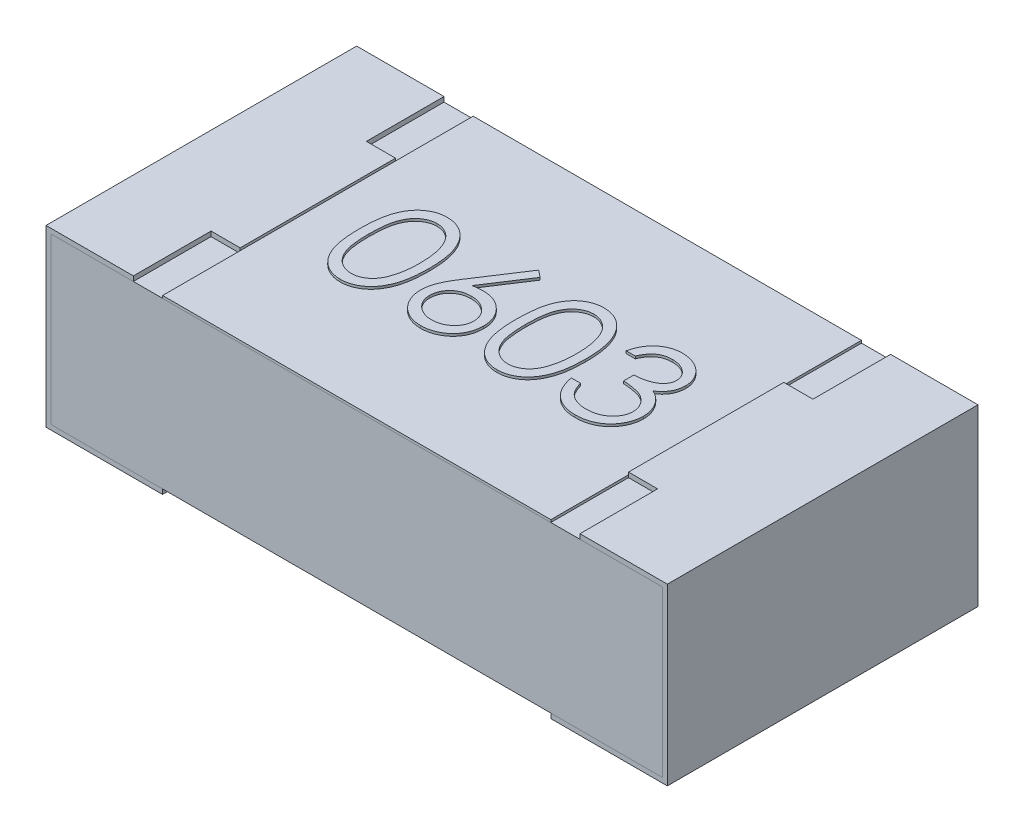
from build123d import *

# Parameters (mm, degrees)
CROQUIS1_W              = 1.6
CROQUIS1_H              = 0.8
SALIENTE_EXTRUIR1_DEPTH = 0.45
CROQUIS2_W              = 1
CROQUIS2_H              = 0.0125
CORTAR_EXTRUIR1_DEPTH   = 2.217579566
CROQUIS3_W              = 0.075
CROQUIS3_H              = 0.2
CORTAR_EXTRUIR3_DEPTH   = 0.0125
CROQUIS4_W              = 1
CROQUIS4_H              = 0.8
SALIENTE_EXTRUIR2_DEPTH = 0.00625
SALIENTE_EXTRUIR2_TAPER = 1
SALIENTE_EXTRUIR3_START = 0.44375
SALIENTE_EXTRUIR3_DEPTH = 0.00625


# Read off the part's stored shape, not the designer's step: Saliente-Extruir3
with BuildPart() as part:
    # Croquis1 → Saliente-Extruir1 (new body)
    with BuildSketch(Plane(origin=(0, 0, 0), x_dir=(1, 0, 0), z_dir=(0, 1, 0))):
        Rectangle(CROQUIS1_W, CROQUIS1_H)
    extrude(amount=SALIENTE_EXTRUIR1_DEPTH)

    # Croquis2 → Cortar-Extruir1 (cut, through all)
    with BuildSketch(Plane.XY.offset(0.4)):
        with Locations((0, 0.00625)):
            Rectangle(CROQUIS2_W, CROQUIS2_H)
        with Locations((0, 0.44375)):
            Rectangle(CROQUIS2_W, CROQUIS2_H)
    extrude(amount=-CORTAR_EXTRUIR1_DEPTH, mode=Mode.SUBTRACT)

    # Croquis3 → Cortar-Extruir3 (cut)
    with BuildSketch(Plane(origin=(0, 0.45, 0), x_dir=(1, 0, 0), z_dir=(0, 1, 0))):
        with Locations((-0.5375, -0.3)):
            Rectangle(CROQUIS3_W, CROQUIS3_H)
        with Locations((-0.5375, 0.3)):
            Rectangle(CROQUIS3_W, CROQUIS3_H)
        with Locations((0.5375, 0.3)):
            Rectangle(CROQUIS3_W, CROQUIS3_H)
        with Locations((0.5375, -0.3)):
            Rectangle(CROQUIS3_W, CROQUIS3_H)
    extrude(amount=-CORTAR_EXTRUIR3_DEPTH, mode=Mode.SUBTRACT)

    # Croquis4 → Saliente-Extruir2 (add)
    with BuildSketch(Plane(origin=(0, 0.4375, 0), x_dir=(1, 0, 0), z_dir=(0, 1, 0))):
        Rectangle(CROQUIS4_W, CROQUIS4_H)
    extrude(amount=SALIENTE_EXTRUIR2_DEPTH, taper=SALIENTE_EXTRUIR2_TAPER)

    # Saliente-Extruir3 outline → Saliente-Extruir3 (add)
    # profile 1 of 4: a face of its own
    with BuildSketch(Plane(origin=(0, 0, 0), x_dir=(1, 0, 0), z_dir=(0, 1, 0)).offset(SALIENTE_EXTRUIR3_START)):
        with BuildLine():
            add(Edge.make_bspline(
                [(-0.301302966, -0.141120437), (-0.303372124, -0.14108548), (-0.307452102, -0.141016551), (-0.313497674, -0.140303417), (-0.319365596, -0.139156892), (-0.325084825, -0.137551538), (-0.330684702, -0.135586518), (-0.33608892, -0.133026414), (-0.341357568, -0.130077997), (-0.34647659, -0.126720207), (-0.351349795, -0.122873218), (-0.356004603, -0.118618261), (-0.360324079, -0.113849155), (-0.364344402, -0.108641205), (-0.368165336, -0.103042323), (-0.371680086, -0.096976066), (-0.374931093, -0.090466488), (-0.377902704, -0.083471532), (-0.380537389, -0.075889126), (-0.382864674, -0.067632525), (-0.384702215, -0.058628856), (-0.386275062, -0.048950432), (-0.387543686, -0.038555663), (-0.388409779, -0.027438908), (-0.38894508, -0.015607092), (-0.388992684, -0.007491369), (-0.389017144, -0.003321411)],
                knots=[0, 0, 0, 0, 0.033787146, 0.066621658, 0.099284878, 0.131361165, 0.163585188, 0.196103927, 0.228902254, 0.262158056, 0.295991222, 0.330217846, 0.365059826, 0.400950737, 0.437620382, 0.475707529, 0.515380692, 0.556413541, 0.59976483, 0.646424156, 0.696431445, 0.749781518, 0.806573307, 0.867435532, 0.931886753, 1, 1, 1, 1], degree=3))
            add(Edge.make_bspline(
                [(-0.210750822, -0.003321411), (-0.210799663, -0.007333474), (-0.210894829, -0.015150817), (-0.211387958, -0.026584286), (-0.212359316, -0.037378141), (-0.21357439, -0.047558269), (-0.215257277, -0.057082298), (-0.217326514, -0.065983185), (-0.219624012, -0.074299369), (-0.222460045, -0.081962722), (-0.225564124, -0.089080146), (-0.228941387, -0.095726489), (-0.232559613, -0.101960496), (-0.236501578, -0.10773227), (-0.24070325, -0.113082696), (-0.245254555, -0.117917331), (-0.250027196, -0.122352667), (-0.255080319, -0.126299346), (-0.260358253, -0.129753786), (-0.265752186, -0.132843108), (-0.271357825, -0.135334176), (-0.277048134, -0.137473116), (-0.282904507, -0.139107242), (-0.288919644, -0.140237153), (-0.295062948, -0.141029601), (-0.299215758, -0.141090053), (-0.301302966, -0.141120437)],
                knots=[0, 0, 0, 0, 0.06506329, 0.126773166, 0.185515763, 0.240764679, 0.292979796, 0.342250373, 0.388919286, 0.432775664, 0.474628433, 0.514774691, 0.553605893, 0.591426406, 0.62802812, 0.663803634, 0.698984336, 0.733591489, 0.767628469, 0.801208348, 0.83426384, 0.866980695, 0.899719742, 0.932701912, 0.966175883, 1, 1, 1, 1], degree=3))
            add(Edge.make_bspline(
                [(-0.301302966, 0.134687835), (-0.299216464, 0.134651269), (-0.295067069, 0.134578551), (-0.28893245, 0.133879644), (-0.282939554, 0.132719954), (-0.277113931, 0.131076794), (-0.271407728, 0.129038251), (-0.265865577, 0.126483137), (-0.260453054, 0.123508875), (-0.25525617, 0.120014026), (-0.250217874, 0.116117521), (-0.24546192, 0.111712769), (-0.240987874, 0.106844245), (-0.236739587, 0.101564039), (-0.232837586, 0.095770877), (-0.229121643, 0.089565517), (-0.225795589, 0.08283944), (-0.222592268, 0.07570487), (-0.219827281, 0.067964397), (-0.217333698, 0.059661654), (-0.215318895, 0.05069857), (-0.213640632, 0.041122174), (-0.212340488, 0.030897294), (-0.211393566, 0.020045851), (-0.210893362, 0.008560704), (-0.210799162, 0.000708229), (-0.210750822, -0.003321411)],
                knots=[0, 0, 0, 0, 0.033788116, 0.067193932, 0.099862411, 0.132566612, 0.165151173, 0.197913187, 0.231319004, 0.265083278, 0.299255309, 0.334398567, 0.369942824, 0.406283561, 0.44406382, 0.482997707, 0.523354447, 0.56553659, 0.609612924, 0.656390811, 0.705885495, 0.7583245, 0.813831783, 0.872794559, 0.93472223, 1, 1, 1, 1], degree=3))
            add(Edge.make_bspline(
                [(-0.389017144, -0.003321411), (-0.388992556, 0.000883557), (-0.388944794, 0.009051766), (-0.388413458, 0.020954), (-0.387530798, 0.032119817), (-0.386321167, 0.042549751), (-0.384849136, 0.052246495), (-0.382884067, 0.061184135), (-0.380649348, 0.069404038), (-0.378059354, 0.076933008), (-0.375136894, 0.083872479), (-0.371956092, 0.090350769), (-0.368390714, 0.096358076), (-0.364644527, 0.101990281), (-0.360565888, 0.107155188), (-0.356270866, 0.111925736), (-0.351591825, 0.116191672), (-0.346687825, 0.120077985), (-0.341514465, 0.123484802), (-0.336219207, 0.12648559), (-0.330765605, 0.129049156), (-0.325138768, 0.131064818), (-0.319389271, 0.132729706), (-0.313497015, 0.133868245), (-0.307452272, 0.134584615), (-0.303372182, 0.134653102), (-0.301302966, 0.134687835)],
                knots=[0, 0, 0, 0, 0.068594622, 0.133246042, 0.194312586, 0.251279223, 0.304513439, 0.354234907, 0.400480589, 0.443410755, 0.484014869, 0.523252301, 0.561042373, 0.597900239, 0.633518489, 0.668314351, 0.702495671, 0.736685354, 0.770293169, 0.803437255, 0.835912952, 0.868460246, 0.900846538, 0.933466525, 0.966257575, 1, 1, 1, 1], degree=3))
        make_face()
        with BuildLine():
            add(Edge.make_bspline(
                [(-0.300514642, 0.107779711), (-0.303416324, 0.107627437), (-0.309224974, 0.107322612), (-0.317803803, 0.105171813), (-0.32602706, 0.101422924), (-0.332566649, 0.097303785), (-0.337578648, 0.093380592), (-0.341107889, 0.089978498), (-0.344417013, 0.086257097), (-0.347465396, 0.08217922), (-0.350320506, 0.077796752), (-0.352942625, 0.073075219), (-0.355305111, 0.067990692), (-0.35748524, 0.062547484), (-0.359402134, 0.056582228), (-0.360983303, 0.05000321), (-0.36244402, 0.042772586), (-0.36347809, 0.034848026), (-0.364397361, 0.026281625), (-0.364988134, 0.017040961), (-0.365447723, 0.007141634), (-0.365464099, 0.000305496), (-0.365472535, -0.003216301)],
                knots=[0, 0, 0, 0, 0.060386619, 0.120883249, 0.182754619, 0.24781103, 0.2812991, 0.315087624, 0.349702396, 0.384856581, 0.420966197, 0.458511188, 0.497174722, 0.537602048, 0.580503018, 0.62746754, 0.67838821, 0.733983221, 0.793746705, 0.857713672, 0.926697864, 1, 1, 1, 1], degree=3))
            add(Edge.make_bspline(
                [(-0.23429543, -0.003216301), (-0.234336671, -6.2985e-05), (-0.234417348, 0.006105574), (-0.234725726, 0.015139418), (-0.235522051, 0.023719732), (-0.236406494, 0.031883481), (-0.237710561, 0.039585473), (-0.239116615, 0.046890187), (-0.241005656, 0.053707126), (-0.243023518, 0.060143018), (-0.245333014, 0.066124743), (-0.247875282, 0.07168019), (-0.250590405, 0.076836179), (-0.253539434, 0.081578564), (-0.256687361, 0.085928588), (-0.260117271, 0.089799031), (-0.263693112, 0.093309853), (-0.268701618, 0.097317319), (-0.275258546, 0.101403425), (-0.283417435, 0.105163768), (-0.291908015, 0.10732319), (-0.297647835, 0.107627647), (-0.300514642, 0.107779711)],
                knots=[0, 0, 0, 0, 0.065681198, 0.128486464, 0.18817513, 0.245106131, 0.299448425, 0.350822936, 0.399941681, 0.446671744, 0.491254533, 0.533376344, 0.573852755, 0.612526312, 0.649597136, 0.685532042, 0.720105786, 0.753837663, 0.818925416, 0.880493462, 0.940311334, 1, 1, 1, 1], degree=3))
            add(Edge.make_bspline(
                [(-0.244228312, -0.069172738), (-0.243437369, -0.066831808), (-0.241831415, -0.062078717), (-0.239761682, -0.054705541), (-0.238131683, -0.046969632), (-0.236665246, -0.038917223), (-0.235664323, -0.030488929), (-0.234858684, -0.021710828), (-0.234384146, -0.012576302), (-0.234325323, -0.006370127), (-0.23429543, -0.003216301)],
                knots=[0, 0, 0, 0, 0.110588339, 0.224541754, 0.342503494, 0.464324098, 0.590756033, 0.722227475, 0.858842836, 1, 1, 1, 1], degree=3))
            add(Edge.make_bspline(
                [(-0.300514642, -0.114212313), (-0.297609431, -0.114092546), (-0.291805007, -0.113853259), (-0.283324685, -0.111544637), (-0.27509199, -0.108061357), (-0.268640179, -0.103942583), (-0.263731716, -0.100020138), (-0.260214896, -0.096675898), (-0.256987036, -0.092931288), (-0.253925582, -0.088891086), (-0.251117712, -0.084478102), (-0.248564395, -0.079713557), (-0.246234439, -0.074584219), (-0.244906998, -0.071003478), (-0.244228312, -0.069172738)],
                knots=[0, 0, 0, 0, 0.112813401, 0.225393884, 0.339594815, 0.45967541, 0.52173519, 0.583925839, 0.648174145, 0.713881038, 0.781004455, 0.851450928, 0.924050693, 1, 1, 1, 1], degree=3))
            add(Edge.make_bspline(
                [(-0.365472535, -0.003216301), (-0.365463582, -0.006720506), (-0.365446204, -0.01352148), (-0.364992242, -0.023404233), (-0.364373818, -0.032621885), (-0.363576164, -0.041186141), (-0.362391601, -0.049068012), (-0.361064329, -0.056321708), (-0.35944912, -0.06290884), (-0.357538056, -0.068874611), (-0.355361333, -0.074320265), (-0.352984714, -0.07938754), (-0.350431579, -0.084136296), (-0.34757423, -0.088523879), (-0.34446233, -0.092564596), (-0.341166167, -0.096329966), (-0.337562726, -0.099687873), (-0.332577715, -0.103715149), (-0.325996637, -0.107876772), (-0.31770471, -0.111500715), (-0.309184311, -0.113778133), (-0.303401181, -0.114067754), (-0.300514642, -0.114212313)],
                knots=[0, 0, 0, 0, 0.072951066, 0.141583694, 0.20592646, 0.265301357, 0.320597233, 0.371816503, 0.41878977, 0.461698729, 0.502133582, 0.540804315, 0.578180525, 0.614296865, 0.649678243, 0.68429946, 0.718358953, 0.752080865, 0.817652439, 0.879722076, 0.93996556, 1, 1, 1, 1], degree=3))
        make_face(mode=Mode.SUBTRACT)
    # profile 2 of 4: a face of its own
    with BuildSketch(Plane(origin=(0, 0, 0), x_dir=(1, 0, 0), z_dir=(0, 1, 0)).offset(SALIENTE_EXTRUIR3_START)):
        with BuildLine():
            add(Edge.make_bspline(
                [(-0.173752151, -0.061236944), (-0.173663592, -0.058535101), (-0.173482771, -0.053018455), (-0.172220218, -0.044663296), (-0.170191486, -0.036114216), (-0.16791948, -0.028861682), (-0.165518893, -0.022920369), (-0.163521063, -0.018130269), (-0.161034395, -0.013200928), (-0.158382865, -0.007963316), (-0.155327798, -0.002552415), (-0.15200597, 0.003122207), (-0.148325541, 0.008970302), (-0.145745463, 0.012938911), (-0.1444265, 0.014967705)],
                knots=[0, 0, 0, 0, 0.09781819, 0.199726053, 0.305276357, 0.415811491, 0.474472231, 0.53727388, 0.603657421, 0.674298863, 0.749834485, 0.828598477, 0.912377778, 1, 1, 1, 1], degree=3))
            add(Edge.make_bspline(
                [(-0.094289097, -0.141120437), (-0.097819388, -0.141005885), (-0.104812276, -0.140778978), (-0.115099019, -0.138757656), (-0.124983252, -0.135481444), (-0.134395726, -0.130967881), (-0.143114926, -0.125266708), (-0.150915514, -0.118403351), (-0.157758595, -0.11052452), (-0.163453527, -0.101631435), (-0.167970421, -0.092074999), (-0.171357783, -0.08211025), (-0.173336402, -0.071773495), (-0.17361289, -0.064766304), (-0.173752151, -0.061236944)],
                knots=[0, 0, 0, 0, 0.084334722, 0.167052318, 0.249566077, 0.332740482, 0.415914886, 0.49782801, 0.580372589, 0.664600121, 0.749466693, 0.832510234, 0.915639282, 1, 1, 1, 1], degree=3))
            add(Edge.make_bspline(
                [(-0.012303406, -0.060763949), (-0.01241008, -0.064435387), (-0.012619988, -0.071659907), (-0.014711611, -0.082182313), (-0.017961778, -0.092206681), (-0.022607511, -0.101572964), (-0.028377983, -0.110268325), (-0.035414892, -0.117972953), (-0.043468678, -0.124844387), (-0.052575128, -0.130590441), (-0.062375404, -0.135283062), (-0.072671082, -0.138653582), (-0.083362177, -0.140728689), (-0.090618491, -0.14098884), (-0.094289097, -0.141120437)],
                knots=[0, 0, 0, 0, 0.085947943, 0.169125212, 0.250399107, 0.332289736, 0.413364288, 0.494172283, 0.576021735, 0.660756969, 0.745783126, 0.830043593, 0.914027546, 1, 1, 1, 1], degree=3))
            add(Edge.make_bspline(
                [(-0.090137257, 0.016964792), (-0.087470802, 0.016893124), (-0.082221964, 0.016752046), (-0.074515736, 0.015666361), (-0.067110681, 0.013955428), (-0.06003749, 0.011461395), (-0.053270777, 0.008275489), (-0.046771709, 0.004457195), (-0.040662453, -0.000190648), (-0.034864337, -0.005382635), (-0.029600229, -0.011133213), (-0.024939615, -0.017234922), (-0.021024781, -0.023681406), (-0.017848502, -0.030469399), (-0.015382007, -0.037588437), (-0.013583933, -0.045029413), (-0.012521054, -0.052797457), (-0.012376722, -0.058080384), (-0.012303406, -0.060763949)],
                knots=[0, 0, 0, 0, 0.065230804, 0.128404896, 0.190067072, 0.250943366, 0.311545833, 0.372862802, 0.435023674, 0.499071725, 0.563091075, 0.625510106, 0.686680036, 0.747282503, 0.808563495, 0.870742104, 0.934340952, 1, 1, 1, 1], degree=3))
            add(Edge.make_bspline(
                [(-0.117308156, 0.014442156), (-0.11269295, 0.015177786), (-0.103690469, 0.016612717), (-0.09457809, 0.016849432), (-0.090137257, 0.016964792)],
                knots=[0, 0, 0, 0, 0.512659336, 1, 1, 1, 1], degree=3))
            Line((-0.117308156, 0.014442156), (-0.047988204, 0.120445449))
            Line((-0.047988204, 0.120445449), (-0.066119655, 0.134687835))
            Line((-0.066119655, 0.134687835), (-0.1444265, 0.014967705))
        make_face()
        with BuildLine():
            add(Edge.make_bspline(
                [(-0.035848015, -0.062182932), (-0.035889264, -0.060391836), (-0.035970222, -0.056876497), (-0.03688591, -0.051727787), (-0.038155882, -0.046756159), (-0.040073544, -0.04199286), (-0.0425649, -0.037456686), (-0.045599469, -0.033124723), (-0.049109961, -0.02896376), (-0.053165023, -0.025098697), (-0.057579338, -0.02156463), (-0.062272899, -0.018444897), (-0.067183268, -0.015811987), (-0.072305467, -0.013615175), (-0.077698187, -0.012029845), (-0.083274363, -0.010781546), (-0.089105316, -0.010117263), (-0.093061364, -0.010002048), (-0.095077421, -0.009943332)],
                knots=[0, 0, 0, 0, 0.061137915, 0.119993844, 0.178225322, 0.23625642, 0.294929377, 0.354715749, 0.416729664, 0.480664408, 0.54583177, 0.609758105, 0.672971228, 0.736016869, 0.799839398, 0.864775357, 0.931087623, 1, 1, 1, 1], degree=3))
            add(Edge.make_bspline(
                [(-0.093027779, -0.114212313), (-0.091081448, -0.114154662), (-0.08726443, -0.114041602), (-0.081629552, -0.113361005), (-0.07622668, -0.112156825), (-0.071051068, -0.110446818), (-0.066063232, -0.108358957), (-0.061333007, -0.105718031), (-0.0568334, -0.10257307), (-0.05257872, -0.099041), (-0.048633367, -0.095190176), (-0.045239457, -0.091050248), (-0.042339826, -0.086725609), (-0.039983571, -0.082213275), (-0.038105018, -0.077481193), (-0.036821621, -0.072555176), (-0.035987388, -0.067431621), (-0.035895087, -0.063955628), (-0.035848015, -0.062182932)],
                knots=[0, 0, 0, 0, 0.067962371, 0.133283403, 0.197835298, 0.260891987, 0.323376504, 0.386350075, 0.449637731, 0.514795327, 0.579239913, 0.641814178, 0.701358565, 0.760726766, 0.819222068, 0.878716169, 0.938147354, 1, 1, 1, 1], degree=3))
            add(Edge.make_bspline(
                [(-0.150207542, -0.062182932), (-0.150160591, -0.063955696), (-0.150068527, -0.067431821), (-0.149232568, -0.072554413), (-0.147955646, -0.077484041), (-0.146056172, -0.082195293), (-0.143790415, -0.08675998), (-0.140799178, -0.091012764), (-0.13748476, -0.095211935), (-0.133522917, -0.099034921), (-0.129271028, -0.102592191), (-0.124728462, -0.105701482), (-0.119994096, -0.108361467), (-0.115004012, -0.110446141), (-0.109829009, -0.112157012), (-0.10442597, -0.113360954), (-0.098791137, -0.114041615), (-0.094974113, -0.114154667), (-0.093027779, -0.114212313)],
                knots=[0, 0, 0, 0, 0.061841703, 0.121262373, 0.180745949, 0.239230902, 0.298307559, 0.358182798, 0.420359231, 0.484792416, 0.549938484, 0.613718278, 0.676680707, 0.73915417, 0.802199703, 0.866740178, 0.932049652, 1, 1, 1, 1], degree=3))
            add(Edge.make_bspline(
                [(-0.095077421, -0.009943332), (-0.097075979, -0.010001653), (-0.100979743, -0.01011557), (-0.106707116, -0.010777097), (-0.112127598, -0.012022834), (-0.117313001, -0.013609428), (-0.122166382, -0.015790945), (-0.126723013, -0.018440857), (-0.131000515, -0.021560712), (-0.134954084, -0.02510631), (-0.138538567, -0.028988255), (-0.141625436, -0.033146159), (-0.144288137, -0.037479816), (-0.14645307, -0.042025435), (-0.148138889, -0.04678128), (-0.14935833, -0.051725476), (-0.150036984, -0.056891179), (-0.150149889, -0.06039417), (-0.150207542, -0.062182932)],
                knots=[0, 0, 0, 0, 0.070599289, 0.137900921, 0.203196198, 0.266789725, 0.329106387, 0.390653545, 0.452653057, 0.51574804, 0.577926341, 0.638930012, 0.698350718, 0.757296037, 0.816393767, 0.87626691, 0.936817109, 1, 1, 1, 1], degree=3))
        make_face(mode=Mode.SUBTRACT)
    # profile 3 of 4: a face of its own
    with BuildSketch(Plane(origin=(0, 0, 0), x_dir=(1, 0, 0), z_dir=(0, 1, 0)).offset(SALIENTE_EXTRUIR3_START)):
        with BuildLine():
            add(Edge.make_bspline(
                [(0.102318896, -0.141120437), (0.100249737, -0.14108548), (0.09616976, -0.141016551), (0.090124187, -0.140303417), (0.084256265, -0.139156892), (0.078537037, -0.137551538), (0.07293716, -0.135586518), (0.067532941, -0.133026414), (0.062264293, -0.130077997), (0.057145271, -0.126720207), (0.052272067, -0.122873218), (0.047617258, -0.118618261), (0.043297782, -0.113849155), (0.039277459, -0.108641205), (0.035456526, -0.103042323), (0.031941776, -0.096976066), (0.028690768, -0.090466488), (0.025719158, -0.083471532), (0.023084472, -0.075889126), (0.020757187, -0.067632525), (0.018919647, -0.058628856), (0.017346799, -0.048950432), (0.016078175, -0.038555663), (0.015212082, -0.027438908), (0.014676781, -0.015607092), (0.014629177, -0.007491369), (0.014604718, -0.003321411)],
                knots=[0, 0, 0, 0, 0.033787146, 0.066621658, 0.099284878, 0.131361165, 0.163585188, 0.196103927, 0.228902254, 0.262158056, 0.295991222, 0.330217846, 0.365059826, 0.400950737, 0.437620382, 0.475707529, 0.515380692, 0.556413541, 0.59976483, 0.646424156, 0.696431445, 0.749781518, 0.806573307, 0.867435532, 0.931886753, 1, 1, 1, 1], degree=3))
            add(Edge.make_bspline(
                [(0.19287104, -0.003321411), (0.192822198, -0.007333474), (0.192727032, -0.015150817), (0.192233903, -0.026584286), (0.191262546, -0.037378141), (0.190047472, -0.047558269), (0.188364585, -0.057082298), (0.186295347, -0.065983185), (0.18399785, -0.074299369), (0.181161816, -0.081962722), (0.178057738, -0.089080146), (0.174680475, -0.095726489), (0.171062248, -0.101960496), (0.167120283, -0.10773227), (0.162918612, -0.113082696), (0.158367307, -0.117917331), (0.153594665, -0.122352667), (0.148541542, -0.126299346), (0.143263609, -0.129753786), (0.137869675, -0.132843108), (0.132264037, -0.135334176), (0.126573727, -0.137473116), (0.120717354, -0.139107242), (0.114702217, -0.140237153), (0.108558914, -0.141029601), (0.104406104, -0.141090053), (0.102318896, -0.141120437)],
                knots=[0, 0, 0, 0, 0.06506329, 0.126773166, 0.185515763, 0.240764679, 0.292979796, 0.342250373, 0.388919286, 0.432775664, 0.474628433, 0.514774691, 0.553605893, 0.591426406, 0.62802812, 0.663803634, 0.698984336, 0.733591489, 0.767628469, 0.801208348, 0.83426384, 0.866980695, 0.899719742, 0.932701912, 0.966175883, 1, 1, 1, 1], degree=3))
            add(Edge.make_bspline(
                [(0.102318896, 0.134687835), (0.104405397, 0.134651269), (0.108554792, 0.134578551), (0.114689411, 0.133879644), (0.120682307, 0.132719954), (0.12650793, 0.131076794), (0.132214133, 0.129038251), (0.137756284, 0.126483137), (0.143168807, 0.123508875), (0.148365691, 0.120014026), (0.153403987, 0.116117521), (0.158159942, 0.111712769), (0.162633987, 0.106844245), (0.166882274, 0.101564039), (0.170784276, 0.095770877), (0.174500218, 0.089565517), (0.177826272, 0.08283944), (0.181029593, 0.07570487), (0.18379458, 0.067964397), (0.186288163, 0.059661654), (0.188302966, 0.05069857), (0.189981229, 0.041122174), (0.191281374, 0.030897294), (0.192228296, 0.020045851), (0.192728499, 0.008560704), (0.192822699, 0.000708229), (0.19287104, -0.003321411)],
                knots=[0, 0, 0, 0, 0.033788116, 0.067193932, 0.099862411, 0.132566612, 0.165151173, 0.197913187, 0.231319004, 0.265083278, 0.299255309, 0.334398567, 0.369942824, 0.406283561, 0.44406382, 0.482997707, 0.523354447, 0.56553659, 0.609612924, 0.656390811, 0.705885495, 0.7583245, 0.813831783, 0.872794559, 0.93472223, 1, 1, 1, 1], degree=3))
            add(Edge.make_bspline(
                [(0.014604718, -0.003321411), (0.014629305, 0.000883557), (0.014677067, 0.009051766), (0.015208404, 0.020954), (0.016091064, 0.032119817), (0.017300695, 0.042549751), (0.018772725, 0.052246495), (0.020737795, 0.061184135), (0.022972513, 0.069404038), (0.025562507, 0.076933008), (0.028484967, 0.083872479), (0.031665769, 0.090350769), (0.035231148, 0.096358076), (0.038977334, 0.101990281), (0.043055973, 0.107155188), (0.047350996, 0.111925736), (0.052030036, 0.116191672), (0.056934037, 0.120077985), (0.062107397, 0.123484802), (0.067402654, 0.12648559), (0.072856257, 0.129049156), (0.078483094, 0.131064818), (0.08423259, 0.132729706), (0.090124846, 0.133868245), (0.096169589, 0.134584615), (0.10024968, 0.134653102), (0.102318896, 0.134687835)],
                knots=[0, 0, 0, 0, 0.068594622, 0.133246042, 0.194312586, 0.251279223, 0.304513439, 0.354234907, 0.400480589, 0.443410755, 0.484014869, 0.523252301, 0.561042373, 0.597900239, 0.633518489, 0.668314351, 0.702495671, 0.736685354, 0.770293169, 0.803437255, 0.835912952, 0.868460246, 0.900846538, 0.933466525, 0.966257575, 1, 1, 1, 1], degree=3))
        make_face()
        with BuildLine():
            add(Edge.make_bspline(
                [(0.10310722, 0.107779711), (0.100205538, 0.107627437), (0.094396888, 0.107322612), (0.085818058, 0.105171813), (0.077594802, 0.101422924), (0.071055213, 0.097303785), (0.066043214, 0.093380592), (0.062513973, 0.089978498), (0.059204849, 0.086257097), (0.056156465, 0.08217922), (0.053301356, 0.077796752), (0.050679237, 0.073075219), (0.04831675, 0.067990692), (0.046136621, 0.062547484), (0.044219727, 0.056582228), (0.042638559, 0.05000321), (0.041177841, 0.042772586), (0.040143771, 0.034848026), (0.0392245, 0.026281625), (0.038633727, 0.017040961), (0.038174138, 0.007141634), (0.038157763, 0.000305496), (0.038149326, -0.003216301)],
                knots=[0, 0, 0, 0, 0.060386619, 0.120883249, 0.182754619, 0.24781103, 0.2812991, 0.315087624, 0.349702396, 0.384856581, 0.420966197, 0.458511188, 0.497174722, 0.537602048, 0.580503018, 0.62746754, 0.67838821, 0.733983221, 0.793746705, 0.857713672, 0.926697864, 1, 1, 1, 1], degree=3))
            add(Edge.make_bspline(
                [(0.169326431, -0.003216301), (0.16928519, -6.2985e-05), (0.169204513, 0.006105574), (0.168896136, 0.015139418), (0.16809981, 0.023719732), (0.167215368, 0.031883481), (0.165911301, 0.039585473), (0.164505246, 0.046890187), (0.162616205, 0.053707126), (0.160598343, 0.060143018), (0.158288847, 0.066124743), (0.15574658, 0.07168019), (0.153031457, 0.076836179), (0.150082428, 0.081578564), (0.146934501, 0.085928588), (0.14350459, 0.089799031), (0.13992875, 0.093309853), (0.134920244, 0.097317319), (0.128363316, 0.101403425), (0.120204426, 0.105163768), (0.111713846, 0.10732319), (0.105974027, 0.107627647), (0.10310722, 0.107779711)],
                knots=[0, 0, 0, 0, 0.065681198, 0.128486464, 0.18817513, 0.245106131, 0.299448425, 0.350822936, 0.399941681, 0.446671744, 0.491254533, 0.533376344, 0.573852755, 0.612526312, 0.649597136, 0.685532042, 0.720105786, 0.753837663, 0.818925416, 0.880493462, 0.940311334, 1, 1, 1, 1], degree=3))
            add(Edge.make_bspline(
                [(0.15939355, -0.069172738), (0.160184493, -0.066831808), (0.161790446, -0.062078717), (0.163860179, -0.054705541), (0.165490178, -0.046969632), (0.166956616, -0.038917223), (0.167957539, -0.030488929), (0.168763177, -0.021710828), (0.169237715, -0.012576302), (0.169296539, -0.006370127), (0.169326431, -0.003216301)],
                knots=[0, 0, 0, 0, 0.110588339, 0.224541754, 0.342503494, 0.464324098, 0.590756033, 0.722227475, 0.858842836, 1, 1, 1, 1], degree=3))
            add(Edge.make_bspline(
                [(0.10310722, -0.114212313), (0.106012431, -0.114092546), (0.111816854, -0.113853259), (0.120297176, -0.111544637), (0.128529872, -0.108061357), (0.134981682, -0.103942583), (0.139890145, -0.100020138), (0.143406965, -0.096675898), (0.146634825, -0.092931288), (0.149696279, -0.088891086), (0.15250415, -0.084478102), (0.155057466, -0.079713557), (0.157387423, -0.074584219), (0.158714863, -0.071003478), (0.15939355, -0.069172738)],
                knots=[0, 0, 0, 0, 0.112813401, 0.225393884, 0.339594815, 0.45967541, 0.52173519, 0.583925839, 0.648174145, 0.713881038, 0.781004455, 0.851450928, 0.924050693, 1, 1, 1, 1], degree=3))
            add(Edge.make_bspline(
                [(0.038149326, -0.003216301), (0.03815828, -0.006720506), (0.038175657, -0.01352148), (0.03862962, -0.023404233), (0.039248043, -0.032621885), (0.040045698, -0.041186141), (0.04123026, -0.049068012), (0.042557532, -0.056321708), (0.044172741, -0.06290884), (0.046083805, -0.068874611), (0.048260528, -0.074320265), (0.050637147, -0.07938754), (0.053190283, -0.084136296), (0.056047631, -0.088523879), (0.059159532, -0.092564596), (0.062455694, -0.096329966), (0.066059136, -0.099687873), (0.071044146, -0.103715149), (0.077625225, -0.107876772), (0.085917151, -0.111500715), (0.09443755, -0.113778133), (0.10022068, -0.114067754), (0.10310722, -0.114212313)],
                knots=[0, 0, 0, 0, 0.072951066, 0.141583694, 0.20592646, 0.265301357, 0.320597233, 0.371816503, 0.41878977, 0.461698729, 0.502133582, 0.540804315, 0.578180525, 0.614296865, 0.649678243, 0.68429946, 0.718358953, 0.752080865, 0.817652439, 0.879722076, 0.93996556, 1, 1, 1, 1], degree=3))
        make_face(mode=Mode.SUBTRACT)
    # profile 4 of 4: a face of its own
    with BuildSketch(Plane(origin=(0, 0, 0), x_dir=(1, 0, 0), z_dir=(0, 1, 0)).offset(SALIENTE_EXTRUIR3_START)):
        with BuildLine():
            add(Edge.make_bspline(
                [(0.30491815, 0.107779711), (0.301930935, 0.107675417), (0.296096209, 0.107471706), (0.287684765, 0.105687471), (0.27986516, 0.102840697), (0.273888082, 0.099442609), (0.269474341, 0.096088191), (0.266320324, 0.093158639), (0.263223006, 0.089902987), (0.260386157, 0.086120711), (0.257517203, 0.082067953), (0.254905312, 0.077538694), (0.252367246, 0.072651081), (0.250837905, 0.069195828), (0.250050804, 0.067417525)],
                knots=[0, 0, 0, 0, 0.122711942, 0.239684964, 0.351815855, 0.463766133, 0.520817793, 0.579448291, 0.640604145, 0.705297512, 0.773633881, 0.844669382, 0.920056508, 1, 1, 1, 1], degree=3))
            add(Edge.make_bspline(
                [(0.3576833, 0.066629201), (0.357652236, 0.06799927), (0.357590437, 0.070724959), (0.356811074, 0.074707126), (0.355639922, 0.078567552), (0.354029837, 0.082289819), (0.35187477, 0.085848112), (0.349295754, 0.089272768), (0.346224853, 0.092544233), (0.3427059, 0.095593563), (0.338927114, 0.098499641), (0.334785682, 0.100966792), (0.330406475, 0.1030765), (0.325784645, 0.104816246), (0.320905191, 0.106124965), (0.315791041, 0.107064631), (0.310432443, 0.107652129), (0.306776595, 0.107736713), (0.30491815, 0.107779711)],
                knots=[0, 0, 0, 0, 0.055274549, 0.109966094, 0.163247443, 0.218076185, 0.273300874, 0.3309093, 0.390994523, 0.454175953, 0.518861541, 0.583310532, 0.648516682, 0.715030887, 0.782502073, 0.852322685, 0.92492849, 1, 1, 1, 1], degree=3))
            add(Edge.make_bspline(
                [(0.29041299, 0.023691823), (0.293658773, 0.023746903), (0.300016466, 0.02385479), (0.309303379, 0.025159666), (0.318183942, 0.02696471), (0.326461348, 0.029729563), (0.334005809, 0.032940801), (0.340551142, 0.03667764), (0.346005647, 0.040831438), (0.350342817, 0.045466308), (0.353605696, 0.050437174), (0.35599138, 0.055618045), (0.357400622, 0.061054328), (0.357588742, 0.064764367), (0.3576833, 0.066629201)],
                knots=[0, 0, 0, 0, 0.110165553, 0.215787256, 0.318027435, 0.417573954, 0.511650488, 0.596162097, 0.672934533, 0.743669557, 0.810677001, 0.874058962, 0.936696302, 1, 1, 1, 1], degree=3))
            Line((0.29041299, 0.023691823), (0.29041299, -0.003216301))
            add(Edge.make_bspline(
                [(0.371137362, -0.058714307), (0.371022653, -0.056269815), (0.370793806, -0.051392994), (0.369046634, -0.044218163), (0.366172816, -0.037305249), (0.362149613, -0.030772195), (0.357252155, -0.024717367), (0.351527968, -0.019315008), (0.344929518, -0.014857228), (0.338856402, -0.011777291), (0.333477005, -0.009675678), (0.328873409, -0.008275833), (0.323719528, -0.007090468), (0.318077687, -0.00598766), (0.311905376, -0.005049081), (0.305209314, -0.00426638), (0.297988144, -0.0036401), (0.292989085, -0.003360423), (0.29041299, -0.003216301)],
                knots=[0, 0, 0, 0, 0.066909186, 0.13348544, 0.201035117, 0.27123434, 0.342879984, 0.41383613, 0.485976622, 0.560229557, 0.599884181, 0.64405484, 0.691891932, 0.744687524, 0.801491775, 0.862857698, 0.929328379, 1, 1, 1, 1], degree=3))
            add(Edge.make_bspline(
                [(0.304340046, -0.114212313), (0.306795195, -0.114166146), (0.311596025, -0.11407587), (0.318601247, -0.113245653), (0.325265602, -0.112036544), (0.331515099, -0.110169108), (0.337431599, -0.107861826), (0.342932166, -0.104964806), (0.348089008, -0.10156584), (0.352836076, -0.09770255), (0.357104617, -0.093473288), (0.360862992, -0.089049766), (0.364058066, -0.084450635), (0.366635402, -0.079650443), (0.368670562, -0.074669069), (0.370056032, -0.069492533), (0.371019361, -0.0641632), (0.371097813, -0.06054054), (0.371137362, -0.058714307)],
                knots=[0, 0, 0, 0, 0.076071737, 0.148751715, 0.218402794, 0.285759581, 0.350598024, 0.414964045, 0.478069339, 0.541760676, 0.604349859, 0.664075021, 0.721463623, 0.777587128, 0.832644447, 0.887843511, 0.943460343, 1, 1, 1, 1], degree=3))
            add(Edge.make_bspline(
                [(0.260509235, -0.100022482), (0.261978162, -0.101154977), (0.264911481, -0.103416473), (0.269691442, -0.106302492), (0.274718515, -0.108803179), (0.280101624, -0.110713394), (0.285724608, -0.11233082), (0.291678351, -0.113389271), (0.29791033, -0.11411548), (0.302165547, -0.114179565), (0.304340046, -0.114212313)],
                knots=[0, 0, 0, 0, 0.118271305, 0.236177533, 0.355662933, 0.475904165, 0.600127342, 0.728608116, 0.861313476, 1, 1, 1, 1], degree=3))
            add(Edge.make_bspline(
                [(0.239960257, -0.06375958), (0.240573663, -0.065779634), (0.241766791, -0.069708813), (0.243797735, -0.075363694), (0.246111569, -0.080547667), (0.248593782, -0.085298761), (0.251200717, -0.089663765), (0.254117715, -0.093527259), (0.257128728, -0.097058936), (0.259398418, -0.099048676), (0.260509235, -0.100022482)],
                knots=[0, 0, 0, 0, 0.149770386, 0.29131641, 0.425966373, 0.552159574, 0.671527414, 0.786121629, 0.895325073, 1, 1, 1, 1], degree=3))
            Line((0.239960257, -0.06375958), (0.216415648, -0.06375958))
            add(Edge.make_bspline(
                [(0.303919607, -0.141120437), (0.301114718, -0.141055357), (0.295595632, -0.140927302), (0.287481878, -0.140051893), (0.279737055, -0.138453031), (0.272350689, -0.136301479), (0.265316221, -0.133573614), (0.258655114, -0.130176599), (0.252326389, -0.126180457), (0.246389767, -0.121538018), (0.240845955, -0.116344804), (0.235842281, -0.110508621), (0.231295324, -0.104137356), (0.227326831, -0.097157006), (0.223756044, -0.089657779), (0.220819104, -0.081543651), (0.218234123, -0.072887159), (0.217032281, -0.066854681), (0.216415648, -0.06375958)],
                knots=[0, 0, 0, 0, 0.06554117, 0.128963168, 0.190377136, 0.250092362, 0.308548432, 0.366397963, 0.424542189, 0.483169996, 0.5422434, 0.601739352, 0.662506002, 0.724855513, 0.789127829, 0.8563464, 0.926295235, 1, 1, 1, 1], degree=3))
            add(Edge.make_bspline(
                [(0.394681971, -0.056454445), (0.394547457, -0.060128133), (0.394279062, -0.067458219), (0.39188009, -0.078287805), (0.388161163, -0.088873835), (0.382879828, -0.098998822), (0.376443342, -0.108472086), (0.368785798, -0.116948099), (0.359994202, -0.124233946), (0.350189227, -0.13032133), (0.339566346, -0.13518747), (0.32820449, -0.138564902), (0.31626737, -0.140764629), (0.308081371, -0.141000513), (0.303919607, -0.141120437)],
                knots=[0, 0, 0, 0, 0.079648251, 0.158921676, 0.239619495, 0.32260943, 0.406034637, 0.487602095, 0.569684627, 0.653036145, 0.737435718, 0.822477816, 0.909747655, 1, 1, 1, 1], degree=3))
            add(Edge.make_bspline(
                [(0.379020601, -0.009838222), (0.380283001, -0.011566593), (0.382787126, -0.014995032), (0.385878074, -0.0205072), (0.388682199, -0.026080465), (0.390867251, -0.031864206), (0.392559351, -0.037791389), (0.393768881, -0.043872189), (0.394520274, -0.050111574), (0.394627881, -0.054332664), (0.394681971, -0.056454445)],
                knots=[0, 0, 0, 0, 0.12813551, 0.254172712, 0.378111645, 0.501712263, 0.623986309, 0.747095614, 0.872874637, 1, 1, 1, 1], degree=3))
            add(Edge.make_bspline(
                [(0.350588384, 0.012550178), (0.353379215, 0.011202564), (0.358908658, 0.008532551), (0.366445759, 0.003296279), (0.373287798, -0.002749587), (0.377103456, -0.007467665), (0.379020601, -0.009838222)],
                knots=[0, 0, 0, 0, 0.2538796, 0.503008917, 0.750291081, 1, 1, 1, 1], degree=3))
            add(Edge.make_bspline(
                [(0.381227909, 0.066524091), (0.381140688, 0.063750123), (0.38097001, 0.058321898), (0.379520787, 0.050397189), (0.377081923, 0.04292822), (0.373703568, 0.035883547), (0.369330382, 0.029307838), (0.364032874, 0.023186298), (0.357773652, 0.017491776), (0.353030368, 0.014229628), (0.350588384, 0.012550178)],
                knots=[0, 0, 0, 0, 0.128067549, 0.250608319, 0.370630166, 0.490072247, 0.610374764, 0.73431307, 0.863216504, 1, 1, 1, 1], degree=3))
            add(Edge.make_bspline(
                [(0.304602821, 0.134687835), (0.308027124, 0.13458445), (0.314801035, 0.134379936), (0.324752733, 0.132512391), (0.334349412, 0.129557148), (0.343486028, 0.125473888), (0.351972695, 0.120437638), (0.359523713, 0.114443613), (0.366036732, 0.107607465), (0.371500774, 0.100056718), (0.375779021, 0.091987039), (0.378933746, 0.083681643), (0.380854305, 0.07516023), (0.381103208, 0.069406632), (0.381227909, 0.066524091)],
                knots=[0, 0, 0, 0, 0.090254249, 0.178539792, 0.266093034, 0.354630978, 0.441886153, 0.525746915, 0.608113634, 0.690197273, 0.770821484, 0.848326181, 0.92401174, 1, 1, 1, 1], degree=3))
            add(Edge.make_bspline(
                [(0.226506195, 0.067417525), (0.227144057, 0.070058494), (0.228391025, 0.075221371), (0.230991897, 0.082597817), (0.233825267, 0.089578202), (0.237227559, 0.096031821), (0.240938653, 0.102088373), (0.245190495, 0.107610489), (0.24978692, 0.112738612), (0.254870966, 0.117289576), (0.260202653, 0.121410615), (0.265857107, 0.124924292), (0.271720566, 0.127946924), (0.277833653, 0.130437057), (0.28421457, 0.132312929), (0.29080563, 0.133673933), (0.297624103, 0.134557776), (0.3022526, 0.134644035), (0.304602821, 0.134687835)],
                knots=[0, 0, 0, 0, 0.072625346, 0.141976611, 0.208984928, 0.27395687, 0.336889347, 0.398744953, 0.460115885, 0.520824923, 0.580994459, 0.640151928, 0.698622451, 0.757271081, 0.816426694, 0.876254048, 0.937165293, 1, 1, 1, 1], degree=3))
            Line((0.226506195, 0.067417525), (0.250050804, 0.067417525))
        make_face()
    extrude(amount=SALIENTE_EXTRUIR3_DEPTH)


solid = part.part
